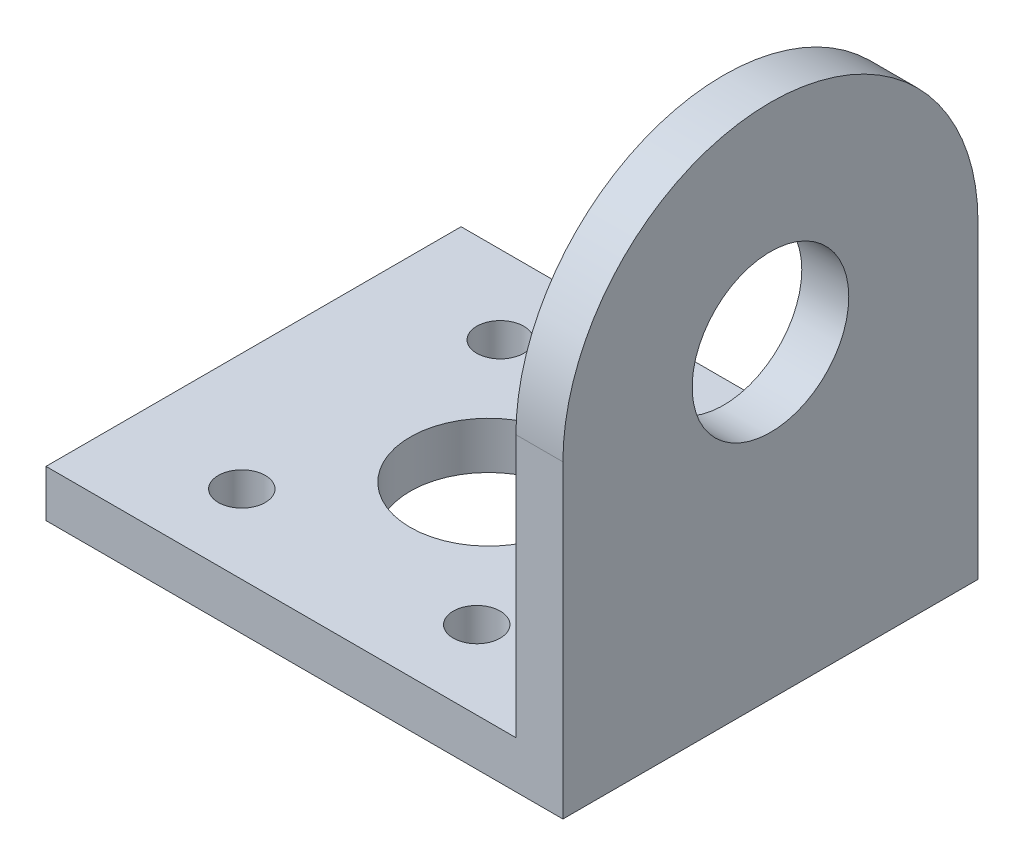
from build123d import *

# Parameters (mm, degrees)
SKETCH1_W           = 30
SKETCH1_H           = 26.5
SKETCH1_R           = 5
SKETCH1_R_2         = 1.5
BOSS_EXTRUDE1_DEPTH = 3
SKETCH2_W           = 3
SKETCH2_H           = 26.5
BOSS_EXTRUDE2_DEPTH = 33
CUT_EXTRUDE1_DEPTH  = 33
SKETCH4_R           = 5
CUT_EXTRUDE2_DEPTH  = 49.513529041


with BuildPart() as part:
    # Sketch1 → Boss-Extrude1 (new body)
    with BuildSketch(Plane(origin=(0, 0, 0), x_dir=(1, 0, 0), z_dir=(0, 1, 0))):
        Rectangle(SKETCH1_W, SKETCH1_H)
        Circle(SKETCH1_R, mode=Mode.SUBTRACT)
        with Locations((7.5, 8.25)):
            Circle(SKETCH1_R_2, mode=Mode.SUBTRACT)
        with Locations((-7.5, 8.25)):
            Circle(SKETCH1_R_2, mode=Mode.SUBTRACT)
        with Locations((-7.5, -8.25)):
            Circle(SKETCH1_R_2, mode=Mode.SUBTRACT)
        with Locations((7.5, -8.25)):
            Circle(SKETCH1_R_2, mode=Mode.SUBTRACT)
    extrude(amount=BOSS_EXTRUDE1_DEPTH)

    # Sketch2 → Boss-Extrude2 (add)
    with BuildSketch(Plane(origin=(0, 0, 0), x_dir=(1, 0, 0), z_dir=(0, 1, 0))):
        with Locations((16.5, 0)):
            Rectangle(SKETCH2_W, SKETCH2_H)
    extrude(amount=BOSS_EXTRUDE2_DEPTH)

    # Sketch3 → Cut-Extrude1 (cut)
    with BuildSketch(Plane.ZY.offset(-15)):
        with BuildLine():
            Line((0, 33), (-13.25, 33))
            Line((-13.25, 33), (-13.25, 19.75))
            ThreePointArc((-13.25, 19.75), (-9.369164851, 29.119164851), (0, 33))
        make_face()
        with BuildLine():
            Line((13.25, 33), (0, 33))
            ThreePointArc((0, 33), (9.369164851, 29.119164851), (13.25, 19.75))
            Line((13.25, 19.75), (13.25, 33))
        make_face()
    extrude(amount=-CUT_EXTRUDE1_DEPTH, mode=Mode.SUBTRACT)

    # Sketch4 → Cut-Extrude2 (cut, through all)
    with BuildSketch(Plane(origin=(18, 0, 0), x_dir=(0, 0, -1), z_dir=(1, 0, 0))):
        with Locations((0, 19.75)):
            Circle(SKETCH4_R)
    extrude(amount=-CUT_EXTRUDE2_DEPTH, mode=Mode.SUBTRACT)


solid = part.part
